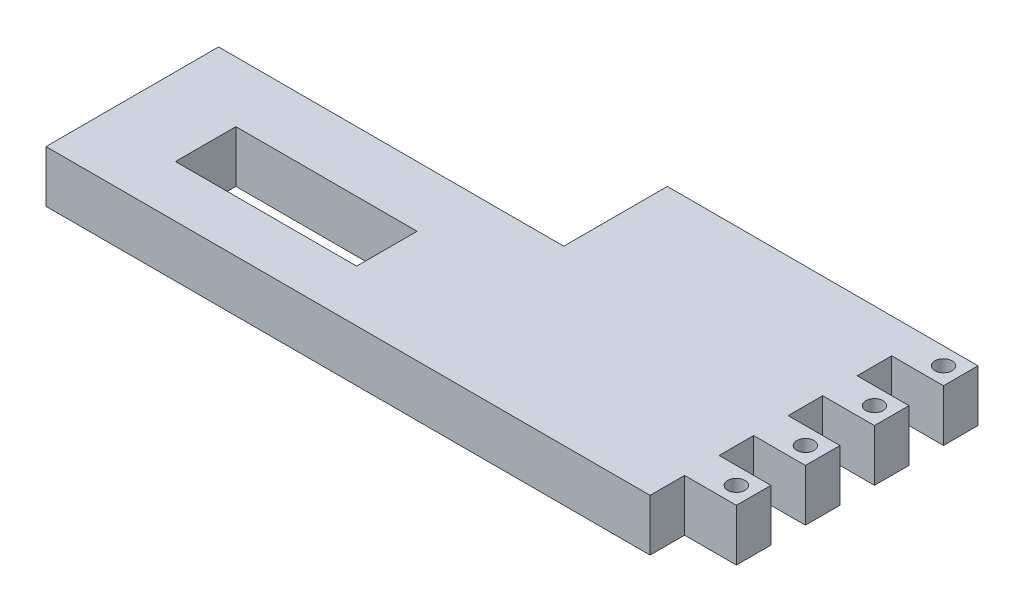
from build123d import *

# Parameters (mm, degrees)
BOSS_EXTRUDE1_DEPTH = 6
SKETCH2_W           = 21
SKETCH2_H           = 7
CUT_EXTRUDE1_DEPTH  = 46.122056691
SKETCH3_R           = 1
CUT_EXTRUDE2_DEPTH  = 46.122056691


with BuildPart() as part:
    # Sketch1 → Boss-Extrude1 (new body)
    with BuildSketch(Plane(origin=(0, 0, 0), x_dir=(1, 0, 0), z_dir=(0, 1, 0))):
        Polygon((-40, 0), (0, 0), (0, 12), (36, 12), (36, 8), (30, 8), (30, 4), (36, 4), (36, 0), (30, 0), (30, -4), (36, -4), (36, -8), (30, -8), (30, -12), (36, -12), (36, -16), (30, -16), (30, -20), (-40, -20), align=None)
    extrude(amount=BOSS_EXTRUDE1_DEPTH)

    # Sketch2 → Cut-Extrude1 (cut, through all)
    with BuildSketch(Plane(origin=(0, 6, 0), x_dir=(1, 0, 0), z_dir=(0, 1, 0))):
        with Locations((-20.5, -10.5)):
            Rectangle(SKETCH2_W, SKETCH2_H)
    extrude(amount=-CUT_EXTRUDE1_DEPTH, mode=Mode.SUBTRACT)

    # Sketch3 → Cut-Extrude2 (cut, through all)
    with BuildSketch(Plane(origin=(0, 6, 0), x_dir=(1, 0, 0), z_dir=(0, 1, 0))):
        with Locations((34, 10)):
            Circle(SKETCH3_R)
        with Locations((34, 2)):
            Circle(SKETCH3_R)
        with Locations((34, -6)):
            Circle(SKETCH3_R)
        with Locations((34, -14)):
            Circle(SKETCH3_R)
    extrude(amount=-CUT_EXTRUDE2_DEPTH, mode=Mode.SUBTRACT)


solid = part.part
